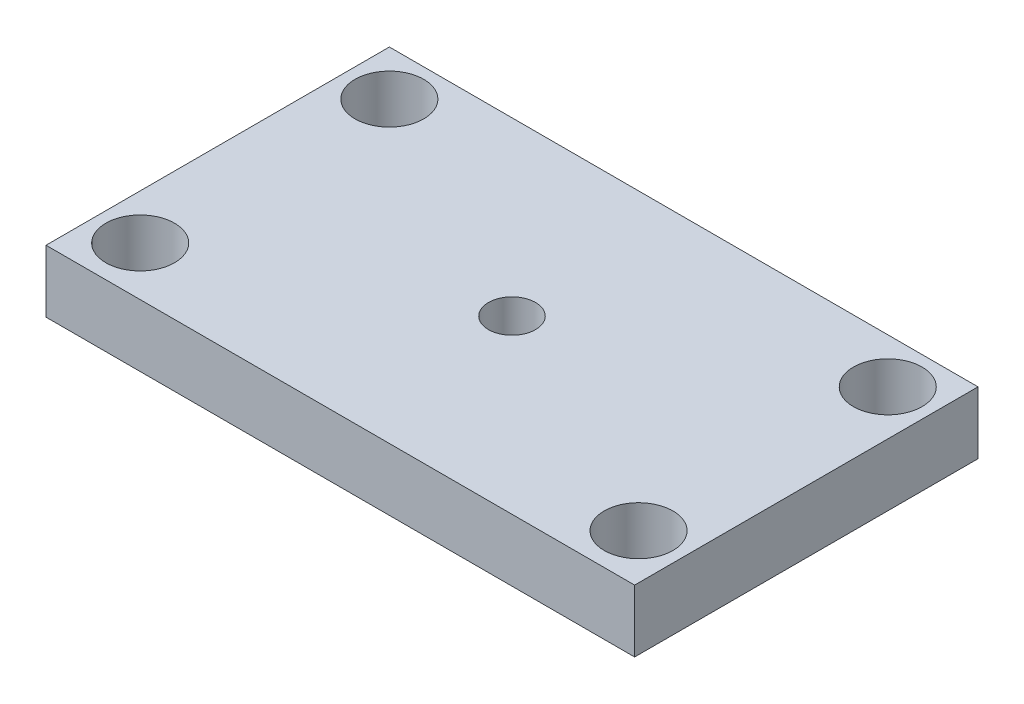
from build123d import *

# Parameters (mm, degrees)
SKETCH1_W           = 60
SKETCH1_H           = 35
SKETCH1_R           = 3.5
SKETCH1_R_2         = 2.4
BOSS_EXTRUDE1_DEPTH = 6.35


with BuildPart() as part:
    # Sketch1 → Boss-Extrude1 (new body)
    with BuildSketch(Plane(origin=(0, 0, 0), x_dir=(1, 0, 0), z_dir=(0, 1, 0))):
        with Locations((30, 17.5)):
            Rectangle(SKETCH1_W, SKETCH1_H)
        with Locations((4.6, 30.4)):
            Circle(SKETCH1_R, mode=Mode.SUBTRACT)
        with Locations((55.4, 30.4)):
            Circle(SKETCH1_R, mode=Mode.SUBTRACT)
        with Locations((4.6, 5)):
            Circle(SKETCH1_R, mode=Mode.SUBTRACT)
        with Locations((55.4, 5)):
            Circle(SKETCH1_R, mode=Mode.SUBTRACT)
        with Locations((30, 17.5)):
            Circle(SKETCH1_R_2, mode=Mode.SUBTRACT)
    extrude(amount=BOSS_EXTRUDE1_DEPTH)


solid = part.part
